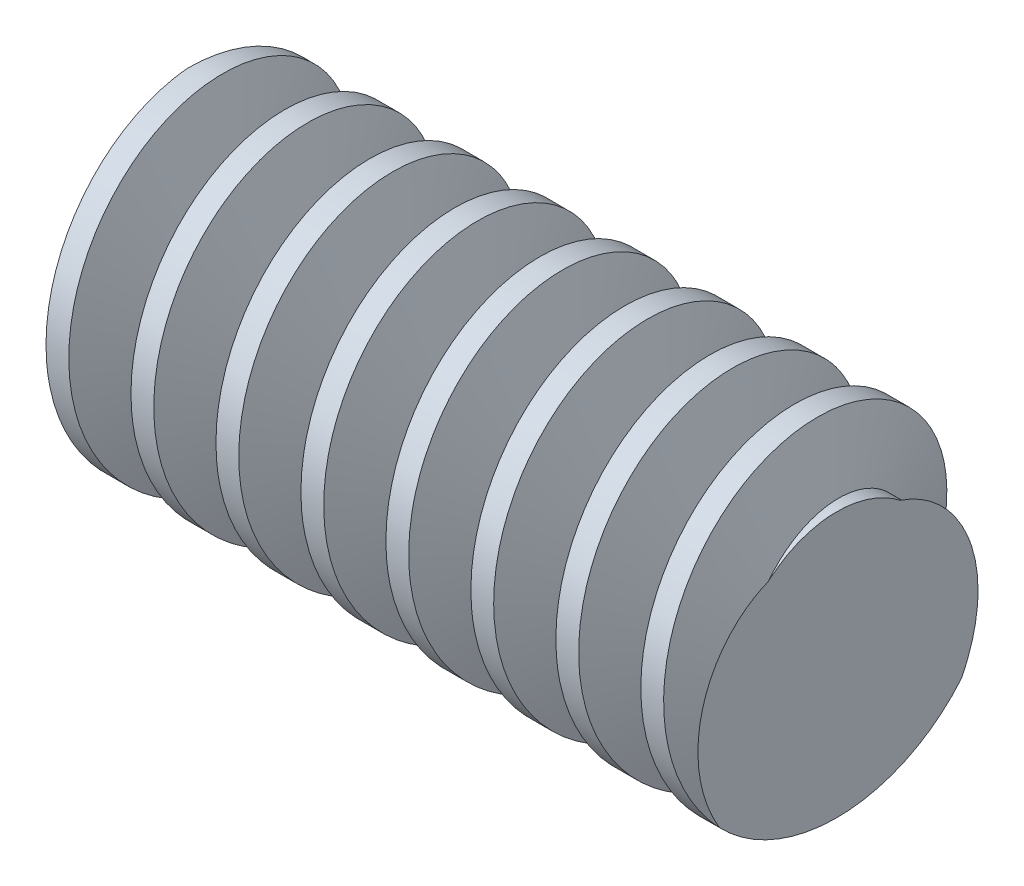
from build123d import *

# Parameters (mm, degrees)
SKETCH_1_R      = 30
EXTRUDE_1_DEPTH = 60
SWEEP_1_PITCH   = 15.707963268


with BuildPart() as part:
    # 草图1 → 凸台-拉伸1 (new, symmetric)
    with BuildSketch(Plane(origin=(0, 0, 0), x_dir=(0, 0, -1), z_dir=(1, 0, 0))):
        Circle(SKETCH_1_R)
    extrude(amount=EXTRUDE_1_DEPTH, both=True)

    # 切除-扫描1: the profile of 草图3 profile screwed along a right-hand helix of 8.639437 turns, 18 arcs to a turn; built about Z, then put on its axis
    sweep_1_z = Axis((0, 0, 0), (0, 0, 1))
    sweep_1_corners = [(30.0003, 0, 0.000109191), (30.0003, 0, -11.493793168), (19, 0, -7.4900114), (19, 0, -4.003672577)]
    with BuildLine(mode=Mode.PRIVATE) as sweep_1_profile:
        Line(sweep_1_corners[0], sweep_1_corners[1])
        Line(sweep_1_corners[1], sweep_1_corners[2])
        Line(sweep_1_corners[2], sweep_1_corners[3])
        Line(sweep_1_corners[3], sweep_1_corners[0])
    sweep_1_cap = Face(sweep_1_profile.wire())
    sweep_1_turn_angles = [0, 10, 20, 30, 40, 50, 60, 70, 80, 90, 100, 110, 120, 130, 140, 150, 160, 170, 180, 190, 200, 210, 220, 230, 240, 250, 260, 270, 280, 290, 300, 310, 320, 330, 340, 350, 360]
    sweep_1_turn_weights = [1, 0.984807753012208, 1, 0.984807753012208, 1, 0.984807753012208, 1, 0.984807753012208, 1, 0.984807753012208, 1, 0.984807753012208, 1, 0.984807753012208, 1, 0.984807753012208, 1, 0.984807753012208, 1, 0.984807753012208, 1, 0.984807753012208, 1, 0.984807753012208, 1, 0.984807753012208, 1, 0.984807753012208, 1, 0.984807753012208, 1, 0.984807753012208, 1, 0.984807753012208, 1, 0.984807753012208, 1]
    sweep_1_turn_rails = [Edge.make_bspline([Vector(p[0], p[1], 0).rotate(sweep_1_z, sweep_1_turn_angles[k]) / sweep_1_turn_weights[k] + Vector(0, 0, p[2] + SWEEP_1_PITCH * sweep_1_turn_angles[k] / 360) for k in range(37)], [0, 0, 0, 1, 1, 2, 2, 3, 3, 4, 4, 5, 5, 6, 6, 7, 7, 8, 8, 9, 9, 10, 10, 11, 11, 12, 12, 13, 13, 14, 14, 15, 15, 16, 16, 17, 17, 18, 18, 18], 2, sweep_1_turn_weights) for p in sweep_1_corners]
    sweep_1_turn_sides = [Face.make_surface_from_curves(sweep_1_turn_rails[p[0]], sweep_1_turn_rails[p[1]]) for p in [(0, 1), (1, 2), (2, 3), (3, 0)]]
    sweep_1_last_angles = [2880, 2890, 2900, 2910, 2920, 2930, 2940, 2950, 2960, 2970, 2980, 2990, 3000, 3010, 3020, 3030, 3040, 3050, 3060, 3070, 3080, 3090, 3100, 3105.098708314, 3110.197416628]
    sweep_1_last_weights = [1, 0.984807753012208, 1, 0.984807753012208, 1, 0.984807753012208, 1, 0.984807753012208, 1, 0.984807753012208, 1, 0.984807753012208, 1, 0.984807753012208, 1, 0.984807753012208, 1, 0.984807753012208, 1, 0.984807753012208, 1, 0.984807753012208, 1, 0.9960430692061701, 1]
    sweep_1_last_rails = [Edge.make_bspline([Vector(p[0], p[1], 0).rotate(sweep_1_z, sweep_1_last_angles[k]) / sweep_1_last_weights[k] + Vector(0, 0, p[2] + SWEEP_1_PITCH * sweep_1_last_angles[k] / 360) for k in range(25)], [0, 0, 0, 1, 1, 2, 2, 3, 3, 4, 4, 5, 5, 6, 6, 7, 7, 8, 8, 9, 9, 10, 10, 11, 11, 12, 12, 12], 2, sweep_1_last_weights) for p in sweep_1_corners]
    sweep_1_last_sides = [Face.make_surface_from_curves(sweep_1_last_rails[p[0]], sweep_1_last_rails[p[1]]) for p in [(0, 1), (1, 2), (2, 3), (3, 0)]]
    sweep_1 = Plane(origin=(-60, 0, 0), x_dir=(0, 1, 0), z_dir=(1, 0, 0)) * Solid(Shell([*[p.moved(Location((0, 0, SWEEP_1_PITCH * i))) for i in range(8) for p in sweep_1_turn_sides], *sweep_1_last_sides, sweep_1_cap, sweep_1_cap.rotate(sweep_1_z, 3110.197416628).moved(Location((0, 0, SWEEP_1_PITCH * 3110.197416628 / 360)))]))
    add(sweep_1, mode=Mode.SUBTRACT)


solid = part.part
